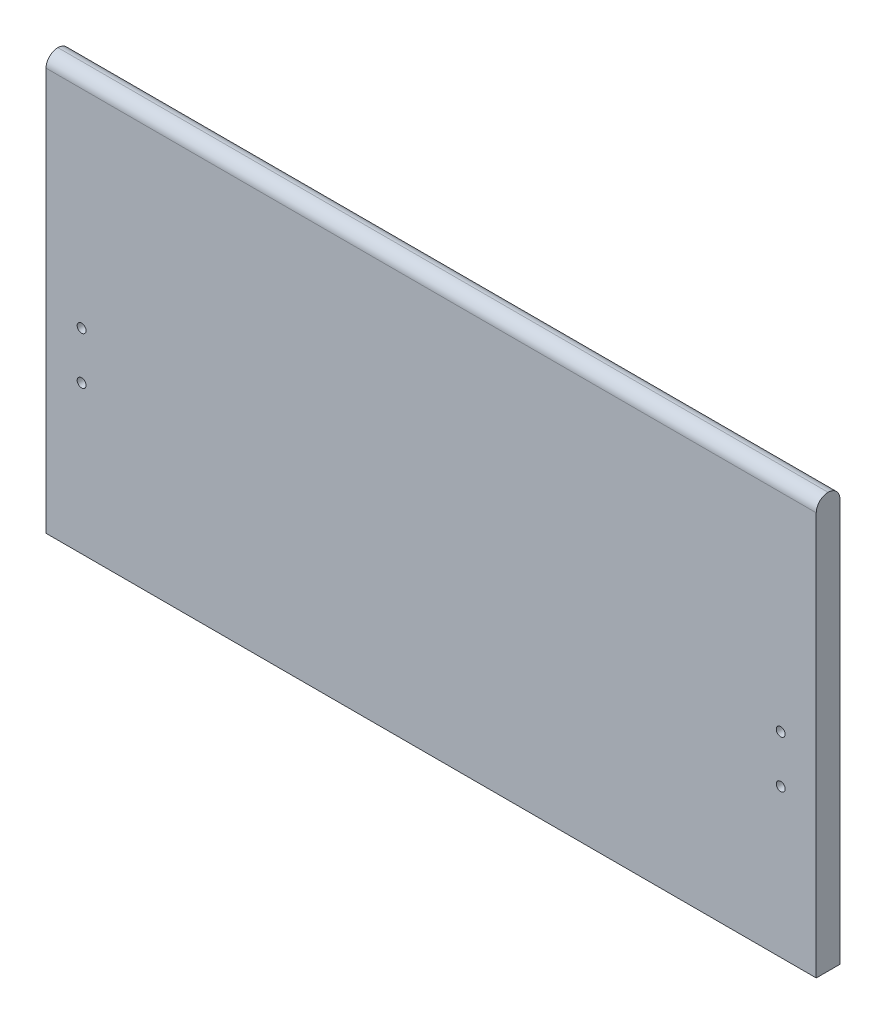
from build123d import *

# Parameters (mm, degrees)
SCHIZZO1_W                   = 1300
SCHIZZO1_H                   = 700
ESTRUSIONE_ESTRUSIONE1_DEPTH = 40
RACCORDO1_R                  = 20
SCHIZZO2_R                   = 7.5
TAGLIO_ESTRUSIONE1_DEPTH     = 30


with BuildPart() as part:
    # Schizzo1 → Estrusione-Estrusione1 (new body)
    with BuildSketch(Plane.XY):
        with Locations((650, -350)):
            Rectangle(SCHIZZO1_W, SCHIZZO1_H)
    extrude(amount=ESTRUSIONE_ESTRUSIONE1_DEPTH)

    # Raccordo1
    raccordo1_edges = [part.edges().sort_by_distance(p)[0] for p in [
        (650, 0, 0),
        (650, 0, 40),
    ]]
    fillet(raccordo1_edges, radius=RACCORDO1_R - 0.0001)  # a hair under: the kernel refuses the full size

    # Schizzo2 → Taglio-Estrusione1 (cut)
    with BuildSketch(Plane.XY.offset(40)):
        with Locations((60, -370)):
            Circle(SCHIZZO2_R)
        with Locations((60, -450)):
            Circle(SCHIZZO2_R)
        with Locations((1240, -370)):
            Circle(SCHIZZO2_R)
        with Locations((1240, -450)):
            Circle(SCHIZZO2_R)
    extrude(amount=-TAGLIO_ESTRUSIONE1_DEPTH, mode=Mode.SUBTRACT)


solid = part.part
